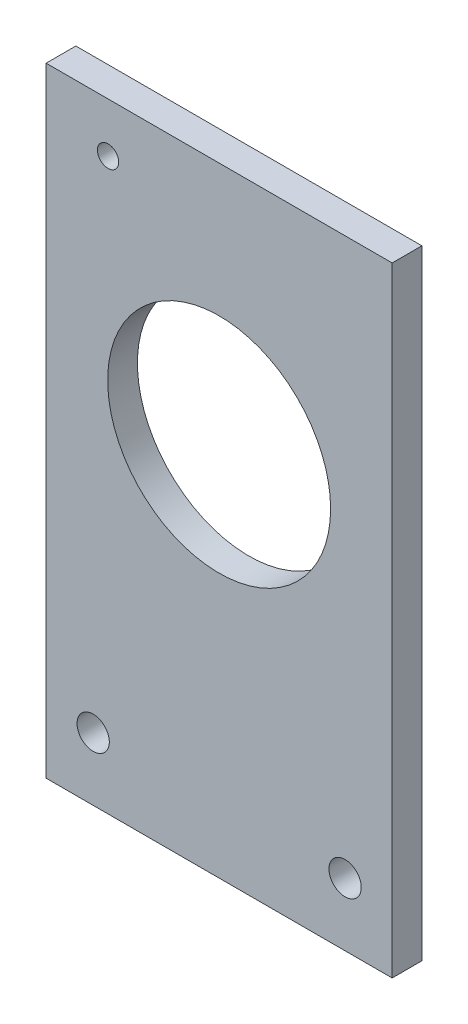
from build123d import *

# Parameters (mm, degrees)
SKETCH2_R           = 22.5
BOSS_EXTRUDE1_DEPTH = 3
SKETCH3_R           = 3.25755
SKETCH3_R_2         = 2.15
CUT_EXTRUDE1_DEPTH  = 6


with BuildPart() as part:
    # Sketch2 → Boss-Extrude1 (new, symmetric)
    with BuildSketch(Plane.XY):
        Polygon((-34.925, 0), (34.925, 0), (34.925, 75.8), (34.925, 108.3), (34.925, 125), (-34.925, 125), (-34.925, 108.3), (-34.925, 75.8), align=None)
        with Locations((0, 75.8)):
            Circle(SKETCH2_R, mode=Mode.SUBTRACT)
    extrude(amount=BOSS_EXTRUDE1_DEPTH, both=True)

    # Sketch3 → Cut-Extrude1 (cut)
    with BuildSketch(Plane.XY.offset(3)):
        with Locations((-25.425, 12.7)):
            Circle(SKETCH3_R)
        with Locations((25.425, 12.7)):
            Circle(SKETCH3_R)
        with Locations((-22.425, 115)):
            Circle(SKETCH3_R_2)
    extrude(amount=-CUT_EXTRUDE1_DEPTH, mode=Mode.SUBTRACT)


solid = part.part
